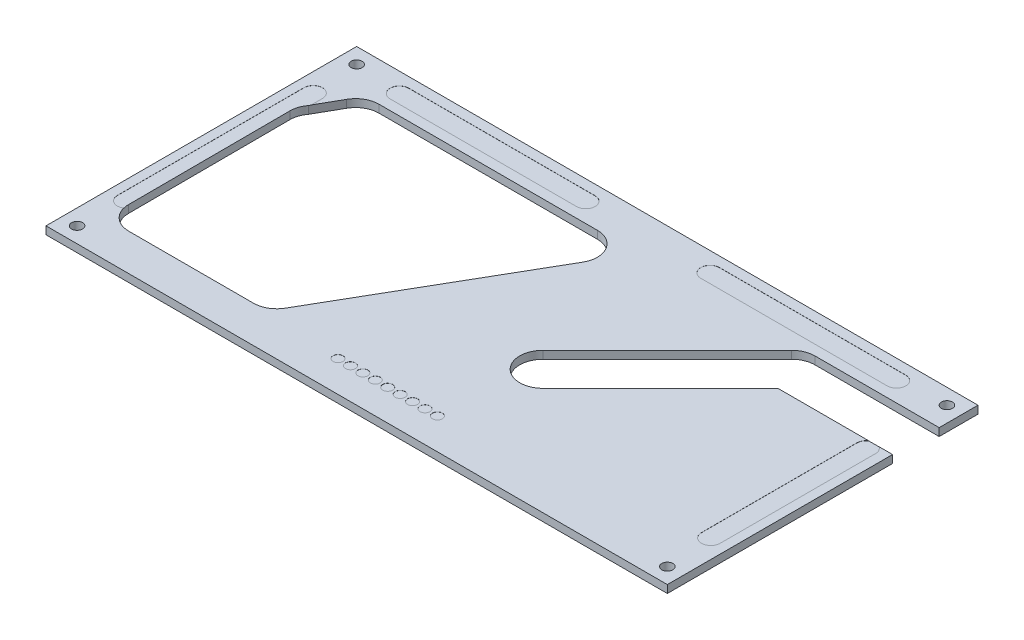
from build123d import *

# Parameters (mm, degrees)
SKETCH1_W           = 127
SKETCH1_H           = 63.5
BOSS_EXTRUDE1_DEPTH = 1.5875
SKETCH2_R           = 1.1303
CUT_EXTRUDE1_DEPTH  = 142.999190689
CUT_EXTRUDE2_DEPTH  = 1.5875
CUT_EXTRUDE3_DEPTH  = 1.5875
SKETCH3_R           = 1.016
CUT_EXTRUDE4_DEPTH  = 0.0254


with BuildPart() as part:
    # Sketch1 → Boss-Extrude1 (new body)
    with BuildSketch(Plane(origin=(0, 0, 0), x_dir=(1, 0, 0), z_dir=(0, 1, 0))):
        with Locations((63.5, 31.75)):
            Rectangle(SKETCH1_W, SKETCH1_H)
    extrude(amount=BOSS_EXTRUDE1_DEPTH)

    # Sketch2 → Cut-Extrude1 (cut, through all)
    with BuildSketch(Plane(origin=(0, 1.5875, 0), x_dir=(1, 0, 0), z_dir=(0, 1, 0))):
        with Locations((3.175, 60.325)):
            Circle(SKETCH2_R)
        with Locations((3.175, 3.175)):
            Circle(SKETCH2_R)
        with Locations((123.825, 3.175)):
            Circle(SKETCH2_R)
        with Locations((123.825, 60.325)):
            Circle(SKETCH2_R)
    extrude(amount=-CUT_EXTRUDE1_DEPTH, mode=Mode.SUBTRACT)

    # Sketch4 → Cut-Extrude2 (cut)
    with BuildSketch(Plane(origin=(0, 1.5875, 0), x_dir=(1, 0, 0), z_dir=(0, 1, 0))):
        with BuildLine():
            Line((98.232403955, 54.167596045), (72.832403955, 28.767596045))
            ThreePointArc((72.832403955, 28.767596045), (72.832403955, 22.032403955), (79.567596045, 22.032403955))
            Line((79.567596045, 22.032403955), (103.572692091, 46.0375))
            Line((103.572692091, 46.0375), (127, 46.0375))
            Line((127, 46.0375), (127, 55.5625))
            Line((127, 55.5625), (101.6, 55.5625))
            ThreePointArc((101.6, 55.5625), (99.777470153, 55.199976274), (98.232403955, 54.167596045))
        make_face()
    extrude(amount=-CUT_EXTRUDE2_DEPTH, mode=Mode.SUBTRACT)

    # Sketch5 → Cut-Extrude3 (cut)
    with BuildSketch(Plane(origin=(0, 1.5875, 0), x_dir=(-1, 0, 0), z_dir=(0, 1, 0))):
        with BuildLine():
            ThreePointArc((-4.650233894, -12.25819272), (-6.050264926, -8.900008545), (-9.412711658, -7.510246043))
            Line((-9.412711658, -7.510246043), (-34.906279557, -7.510246043))
            ThreePointArc((-34.906279557, -7.510246043), (-37.287529557, -8.148300057), (-39.030725542, -9.891496043))
            Line((-39.030725542, -9.891496043), (-61.274445986, -48.41875))
            ThreePointArc((-61.274445986, -48.41875), (-61.274445986, -53.18125), (-57.15, -55.5625))
            Line((-57.15, -55.5625), (-12.489472227, -55.5625))
            ThreePointArc((-12.489472227, -55.5625), (-10.065969168, -54.899760868), (-8.316964929, -53.095994141))
            Line((-8.316964929, -53.095994141), (-5.499068963, -48.1499644))
            ThreePointArc((-5.499068963, -48.1499644), (-4.790682084, -46.79307626), (-4.549320114, -45.281553255))
            Line((-4.549320114, -45.281553255), (-4.650233894, -12.25819272))
        make_face()
    extrude(amount=-CUT_EXTRUDE3_DEPTH, mode=Mode.SUBTRACT)

    # Sketch3 → Cut-Extrude4 (cut)
    with BuildSketch(Plane(origin=(0, 1.5875, 0), x_dir=(1, 0, 0), z_dir=(0, 1, 0))):
        with Locations((63.5, 6.35)):
            Circle(SKETCH3_R)
        with Locations((66.04, 6.35)):
            Circle(SKETCH3_R)
        with Locations((68.58, 6.35)):
            Circle(SKETCH3_R)
        with Locations((71.12, 6.35)):
            Circle(SKETCH3_R)
        with Locations((73.66, 6.35)):
            Circle(SKETCH3_R)
        with Locations((60.96, 6.35)):
            Circle(SKETCH3_R)
        with Locations((58.42, 6.35)):
            Circle(SKETCH3_R)
        with Locations((55.88, 6.35)):
            Circle(SKETCH3_R)
        with Locations((53.34, 6.35)):
            Circle(SKETCH3_R)
        with BuildLine():
            Line((5.715, 50.8), (5.715, 12.7))
            ThreePointArc((5.715, 12.7), (3.81, 10.795), (1.905, 12.7))
            Line((1.905, 12.7), (1.905, 50.8))
            ThreePointArc((1.905, 50.8), (3.81, 52.705), (5.715, 50.8))
        make_face()
        with BuildLine():
            Line((50.8, 57.634853503), (12.7, 57.634853503))
            ThreePointArc((12.7, 57.634853503), (10.795, 59.539853503), (12.7, 61.444853503))
            Line((12.7, 61.444853503), (50.8, 61.444853503))
            ThreePointArc((50.8, 61.444853503), (52.705, 59.539853503), (50.8, 57.634853503))
        make_face()
        with BuildLine():
            Line((76.2, 57.634853503), (114.3, 57.634853503))
            ThreePointArc((114.3, 57.634853503), (116.205, 59.539853503), (114.3, 61.444853503))
            Line((114.3, 61.444853503), (76.2, 61.444853503))
            ThreePointArc((76.2, 61.444853503), (74.295, 59.539853503), (76.2, 57.634853503))
        make_face()
        with BuildLine():
            Line((125.095, 44.45), (125.095, 12.7))
            ThreePointArc((125.095, 12.7), (123.19, 10.795), (121.285, 12.7))
            Line((121.285, 12.7), (121.285, 44.45))
            ThreePointArc((121.285, 44.45), (123.19, 46.355), (125.095, 44.45))
        make_face()
    extrude(amount=-CUT_EXTRUDE4_DEPTH, mode=Mode.SUBTRACT)


solid = part.part
